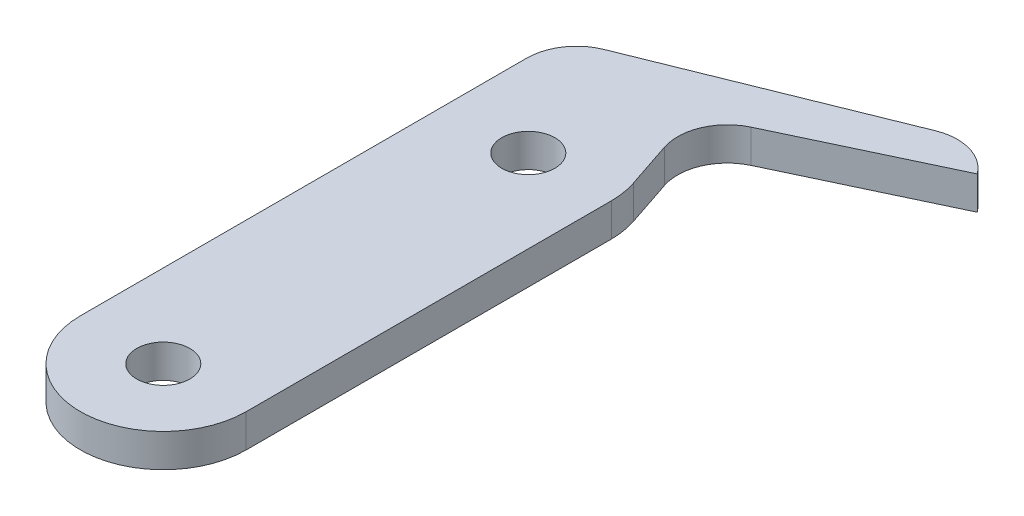
from build123d import *

# Parameters (mm, degrees)
BOSS_EXTRUDE1_DEPTH      = 1
BOSS_EXTRUDE1_DEPTH_BACK = 1
SKETCH1_R                = 1.6
BOSS_EXTRUDE4_START      = -2
BOSS_EXTRUDE4_DEPTH      = 2
FILLET1_R                = 3


with BuildPart() as part:
    # Sketch1 → Boss-Extrude1 (new, two sides: drawn at the far end of the back side and taken through both)
    with BuildSketch(Plane(origin=(0, 0, 0), x_dir=(1, 0, 0), z_dir=(0, 1, 0)).offset(-BOSS_EXTRUDE1_DEPTH_BACK)):
        with BuildLine():
            ThreePointArc((5, 11), (0, 16), (-5, 11))
            Line((-5, 11), (-5, -11))
            ThreePointArc((-5, -11), (0, -16), (5, -11))
            Line((5, -11), (5, 11))
        make_face()
        with Locations(Location((0, 11, 0), (0, 0, 270))):
            Circle(SKETCH1_R, mode=Mode.SUBTRACT)
        with Locations(Location((0, -11, 0), (0, 0, 270))):
            Circle(SKETCH1_R, mode=Mode.SUBTRACT)
    extrude(amount=BOSS_EXTRUDE1_DEPTH + BOSS_EXTRUDE1_DEPTH_BACK)

    # Sketch4 → Boss-Extrude4 (add)
    with BuildSketch(Plane(origin=(0, 1, 0), x_dir=(1, 0, 0), z_dir=(0, 1, 0)).offset(BOSS_EXTRUDE4_START)):
        with BuildLine():
            Line((2.958312472, 17.926759894), (-2.135268449, 15.521131346))
            ThreePointArc((-2.135268449, 15.521131346), (1.963819075, 15.59819689), (4.742555811, 12.58371853))
            Line((4.742555811, 12.58371853), (2.958312472, 17.926759894))
        make_face()
        with BuildLine():
            ThreePointArc((-5, 11), (-4.223525911, 13.676159352), (-2.135268449, 15.521131346))
            Line((-2.135268449, 15.521131346), (2.958312472, 17.926759894))
            Line((2.958312472, 17.926759894), (14.623518216, 23.436076894))
            Line((14.623518216, 23.436076894), (13.666416412, 25.462605676))
            Line((13.666416412, 25.462605676), (-5, 17.926759894))
            Line((-5, 17.926759894), (-5, 11))
        make_face()
    extrude(amount=BOSS_EXTRUDE4_DEPTH)

    # Fillet1
    # the kernel refuses this fillet: 3 mm, written as the material it adds along each edge
    with BuildSketch(Plane(origin=(2.958312472, -1, -17.926759894), x_dir=(0.9042262692177064, 0, -0.42705368989932413), z_dir=(0, 1, 0))) as fillet1_piece_1:
        with BuildLine():
            CenterArc((FILLET1_R * 0.887613530768, -FILLET1_R), FILLET1_R, 90, 83.185387179)
            Line((-FILLET1_R * 0.105321747078, -FILLET1_R * 0.881342787793), (0, 0))
            Line((0, 0), (FILLET1_R * 0.887613530768, 0))
        make_face()
    extrude(amount=2)
    # the kernel refuses this fillet: 3 mm, written as the material it takes off along each edge
    with BuildSketch(Plane(origin=(13.666416412, -7.931521676, -25.462605676), x_dir=(0.42705368989932463, 0, 0.904226269217706), z_dir=(0, 1, 0))) as fillet1_2_piece_1:
        with BuildLine():
            CenterArc((2.835616342, -2.940516757), FILLET1_R, 101.428639538, 75.275128979)
            Line((-0.159420459, -2.768021668), (0, 0))
            Line((0, 0), (2.241174417, 0))
        make_face()
    extrude(amount=15.863043352, mode=Mode.SUBTRACT)
    with BuildSketch(Plane(origin=(-5, -6.060290677, -17.926759894), x_dir=(0, 0, 1), z_dir=(0, 1, 0))) as fillet1_2_piece_2:
        with BuildLine():
            CenterArc((FILLET1_R * 0.674705423588, FILLET1_R), FILLET1_R, 201.984493206, 68.015506794)
            Line((-FILLET1_R * 0.252579782273, FILLET1_R * 0.625644357607), (0, 0))
            Line((0, 0), (FILLET1_R * 0.674705423588, 0))
        make_face()
    extrude(amount=12.120581354, mode=Mode.SUBTRACT)


solid = part.part
